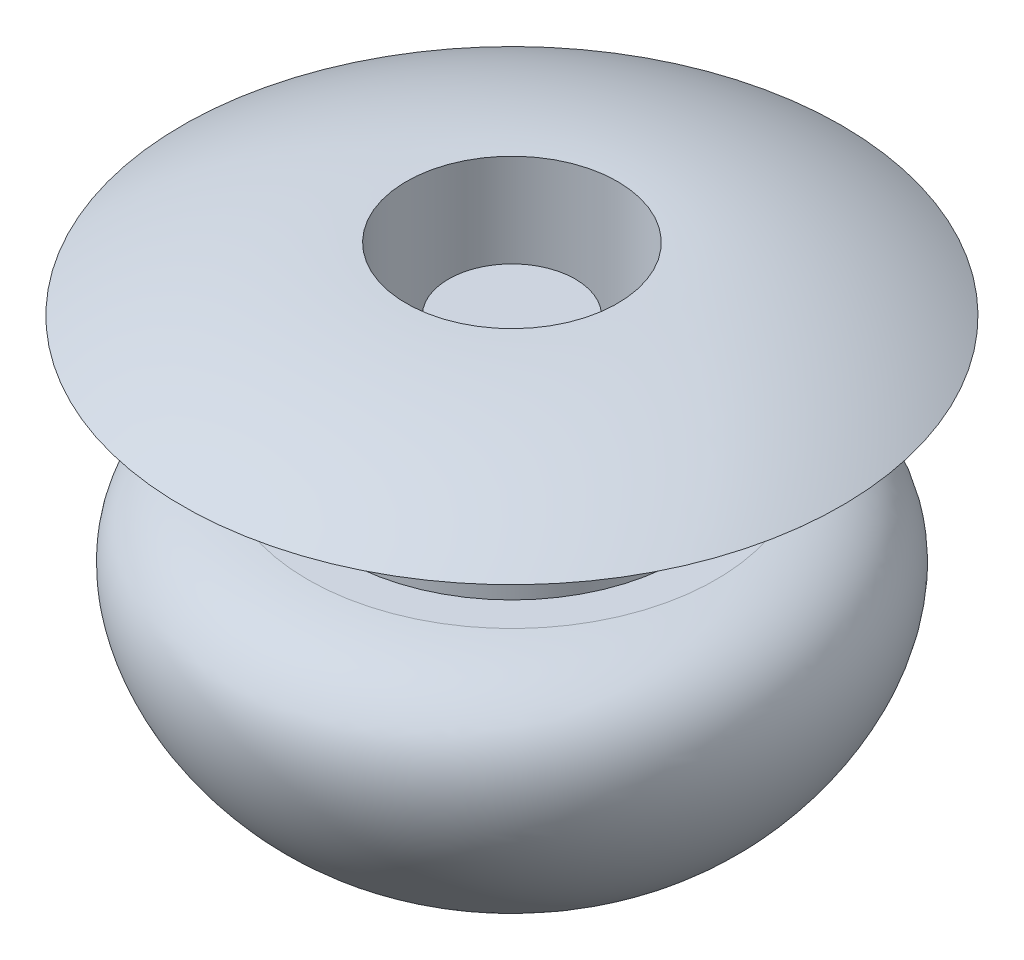
from build123d import *


with BuildPart() as part:
    # Szkic1 → Obrót1 (revolve)
    with BuildSketch(Plane(origin=(0, 0, 0), x_dir=(0, 0, -1), z_dir=(1, 0, 0))):
        with BuildLine():
            Line((0, 0), (-0.75, 0))
            Line((-0.75, 0), (-0.75, -1.700753029))
            Line((-0.75, -1.700753029), (-1.25, -1.700753029))
            Line((-1.25, -1.700753029), (-1.25, 0.75))
            ThreePointArc((-1.25, 0.75), (-2.627043935, 0.558888572), (-3.9, 0))
            Line((-3.9, 0), (-2, 0))
            Line((-2, 0), (-2, -1.500014506))
            Line((-2, -1.500014506), (-2.413891755, -1.500014506))
            add(Edge.make_bspline(
                [(-2.413891755, -1.500014506), (-3.867503112, -1.669671828), (-3.528877649, -3.802028133), (-1.083961642, -5.373546875), (-0.271752618, -3.374963804), (-0.956030427, -3.0789437)],
                knots=[0, 0, 0, 0, 0.464993082, 0.721927553, 1, 1, 1, 1], degree=3))
            add(Edge.make_bspline(
                [(-0.956030427, -3.0789437), (-0.520263876, -3.200753029), (0, -3.200753029)],
                knots=[0.992852221, 0.992852221, 0.992852221, 1.570796327, 1.570796327, 1.570796327], degree=2, weights=[1, 0.958537313, 1]))
            Line((0, -3.200753029), (0, -1.700753029))
            Line((0, -1.700753029), (0, 0))
        make_face()
    revolve(axis=Axis((0, 0, 0), (0, 1, 0)))


solid = part.part
